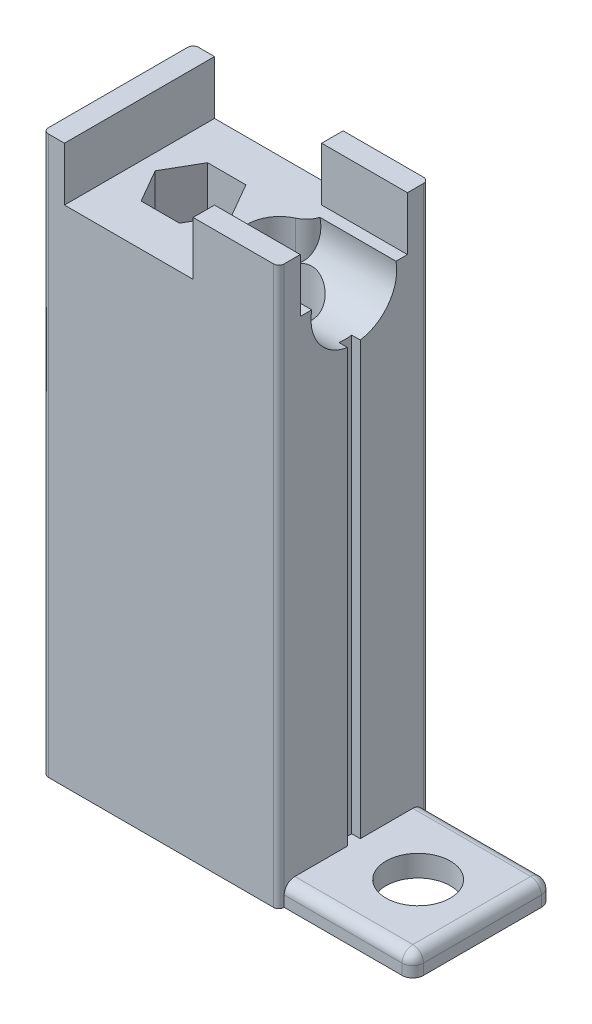
from build123d import *

# Parameters (mm, degrees)
SKETCH1_W                = 22
SKETCH1_H                = 14
BOSS_EXTRUDE1_DEPTH      = 47
SKETCH2_W                = 8
SKETCH2_H                = 2
SKETCH2_W_2              = 2
SKETCH2_H_2              = 14
BOSS_EXTRUDE2_DEPTH      = 5
SKETCH3_R                = 3
CUT_EXTRUDE1_DEPTH       = 54.749418602
SKETCH4_W                = 1.2
SKETCH4_H                = 47
CUT_EXTRUDE2_DEPTH       = 0.8
SKETCH5_R                = 4
CUT_EXTRUDE3_DEPTH       = 7
CUT_EXTRUDE4_DEPTH       = 1
FILLET1_R                = 2
FILLET2_R                = 0.5
BOSS_EXTRUDE3_DEPTH      = 12
BOSS_EXTRUDE3_DEPTH_BACK = 1
SKETCH8_W                = 13
SKETCH8_H                = 2
FILLET4_R                = 1
SKETCH9_R                = 3
CUT_EXTRUDE5_DEPTH       = 63.064482677


with BuildPart() as part:
    # Sketch1 → Boss-Extrude1 (new body)
    with BuildSketch(Plane(origin=(0, 0, 0), x_dir=(1, 0, 0), z_dir=(0, 1, 0))):
        with Locations((11, 7)):
            Rectangle(SKETCH1_W, SKETCH1_H)
    extrude(amount=BOSS_EXTRUDE1_DEPTH)

    # Sketch2 → Boss-Extrude2 (add)
    with BuildSketch(Plane(origin=(0, 47, 0), x_dir=(1, 0, 0), z_dir=(0, 1, 0))):
        with Locations((18, 1)):
            Rectangle(SKETCH2_W, SKETCH2_H)
        with Locations((1, 7)):
            Rectangle(SKETCH2_W_2, SKETCH2_H_2)
        with Locations((18, 13)):
            Rectangle(SKETCH2_W, SKETCH2_H)
    extrude(amount=BOSS_EXTRUDE2_DEPTH)

    # Sketch3 → Cut-Extrude1 (cut, through all)
    with BuildSketch(Plane(origin=(0, 47, 0), x_dir=(1, 0, 0), z_dir=(0, 1, 0))):
        with Locations(Location((15.082903769, 7, 0), (0, 0, 270))):
            Circle(SKETCH3_R)
        Polygon((10.621023553, 7), (8.831237719, 10.1), (5.25166605, 10.1), (3.461880215, 7), (5.25166605, 3.9), (8.831237719, 3.9), align=None)
    extrude(amount=-CUT_EXTRUDE1_DEPTH, mode=Mode.SUBTRACT)

    # Sketch4 → Cut-Extrude2 (cut)
    with BuildSketch(Plane(origin=(22, 0, 0), x_dir=(0, 0, -1), z_dir=(1, 0, 0))):
        with Locations((7, 23.5)):
            Rectangle(SKETCH4_W, SKETCH4_H)
    extrude(amount=-CUT_EXTRUDE2_DEPTH, mode=Mode.SUBTRACT)

    # Sketch5 → Cut-Extrude3 (cut)
    with BuildSketch(Plane(origin=(22, 0, 0), x_dir=(0, 0, -1), z_dir=(1, 0, 0))):
        with Locations((7, 46.25)):
            Circle(SKETCH5_R)
    extrude(amount=-CUT_EXTRUDE3_DEPTH, mode=Mode.SUBTRACT)

    # Sketch7 → Cut-Extrude4 (cut)
    # profile 1 of 9: a face of its own
    with BuildSketch(Plane.ZY):
        with BuildLine():
            add(Edge.make_bspline(
                [(-10.951322115, 35.58974359), (-10.890470326, 35.588168028), (-10.770335111, 35.585057512), (-10.593659562, 35.559128935), (-10.423400003, 35.516882035), (-10.259633426, 35.458155789), (-10.102769882, 35.381359592), (-9.952256062, 35.288670665), (-9.808631099, 35.178339561), (-9.673366747, 35.052940123), (-9.54835809, 34.91657371), (-9.440038016, 34.769751021), (-9.34766663, 34.616276382), (-9.271108979, 34.455738551), (-9.212796077, 34.287025729), (-9.171875502, 34.110998126), (-9.14558606, 33.927705822), (-9.14256237, 33.802908746), (-9.141025641, 33.739483173)],
                knots=[0, 0, 0, 0, 1.014329547, 2.002516266, 2.970391464, 3.935626869, 4.897733899, 5.877609409, 6.878433252, 7.912639331, 8.949961323, 9.958554974, 10.949718813, 11.932905612, 12.9188844, 13.919928257, 14.942845884, 16, 16, 16, 16], degree=3))
            add(Edge.make_bspline(
                [(-9.141025641, 33.739483173), (-9.142662191, 33.67677226), (-9.145887065, 33.553198393), (-9.170802252, 33.371595199), (-9.212411935, 33.197453219), (-9.269735803, 33.030378278), (-9.344904989, 32.871179629), (-9.435475032, 32.718840812), (-9.543835904, 32.574775566), (-9.666035258, 32.439061204), (-9.800566143, 32.315871298), (-9.943055706, 32.207310407), (-10.092846019, 32.115320004), (-10.249717836, 32.039942227), (-10.414007563, 31.98144431), (-10.585309383, 31.940169778), (-10.763612695, 31.915086412), (-10.884867595, 31.911882603), (-10.946414263, 31.91025641)],
                knots=[0, 0, 0, 0, 1.051557043, 2.072126891, 3.067553643, 4.050577992, 5.02905126, 6.015227836, 7.017913613, 8.04756643, 9.074058332, 10.072836633, 11.047628519, 12.017157415, 12.98668631, 13.966869689, 14.968021931, 16, 16, 16, 16], degree=3))
            add(Edge.make_bspline(
                [(-10.946414263, 31.91025641), (-11.010784698, 31.911715185), (-11.137263805, 31.914581478), (-11.322366544, 31.941838618), (-11.499710962, 31.982897391), (-11.667807263, 32.044175408), (-11.828367367, 32.120778081), (-11.980211588, 32.215118866), (-12.1232889, 32.327041858), (-12.256778585, 32.453680666), (-12.377720564, 32.592251298), (-12.484475583, 32.738638882), (-12.574525809, 32.891725147), (-12.647874538, 33.051581739), (-12.70569973, 33.217215189), (-12.746488832, 33.389634252), (-12.770583928, 33.568425405), (-12.773940235, 33.68986393), (-12.775641026, 33.751402244)],
                knots=[0, 0, 0, 0, 1.067978421, 2.098431617, 3.099715153, 4.085208694, 5.062210972, 6.048429807, 7.046490867, 8.072918869, 9.098532598, 10.095778865, 11.076610158, 12.041847152, 13.011192615, 13.984257998, 14.978533688, 16, 16, 16, 16], degree=3))
            add(Edge.make_bspline(
                [(-12.775641026, 33.751402244), (-12.77510722, 33.792801999), (-12.774046367, 33.875077294), (-12.761267278, 33.997005082), (-12.742869064, 34.116553003), (-12.715658978, 34.233244418), (-12.682605678, 34.34790253), (-12.63978046, 34.459460075), (-12.591033771, 34.569108792), (-12.534077855, 34.675553593), (-12.470748384, 34.777815097), (-12.401650293, 34.87541092), (-12.326609835, 34.967160983), (-12.24586874, 35.053668232), (-12.159148765, 35.134364048), (-12.06759062, 35.210390793), (-11.969418611, 35.279728925), (-11.866781415, 35.34407182), (-11.760257677, 35.402255985), (-11.650281045, 35.451780605), (-11.539117256, 35.495029613), (-11.42528131, 35.529163642), (-11.309993162, 35.556965452), (-11.192021192, 35.575351265), (-11.07243121, 35.588130001), (-10.991787619, 35.58920445), (-10.951322115, 35.58974359)],
                knots=[0, 0, 0, 0, 1.034744296, 2.056386356, 3.06226378, 4.057406941, 5.050368692, 6.043467995, 7.042652155, 8.049140477, 9.059438543, 10.048523776, 11.036952808, 12.020949711, 13.004946614, 13.997082645, 14.994316842, 16.007702937, 17.024872941, 18.026463647, 19.021641123, 20.005082605, 20.995858141, 21.984425357, 22.988620895, 24, 24, 24, 24], degree=3))
        make_face()
        with BuildLine():
            add(Edge.make_bspline(
                [(-10.961137821, 34.961538462), (-11.002091067, 34.960439594), (-11.082916387, 34.958270869), (-11.201472412, 34.941748119), (-11.315290383, 34.91535941), (-11.423739361, 34.877135687), (-11.527289375, 34.828486588), (-11.626123986, 34.7695821), (-11.718874539, 34.698397447), (-11.806777773, 34.618754215), (-11.886183881, 34.530013352), (-11.956341682, 34.434912425), (-12.015052461, 34.333610251), (-12.064223106, 34.227047904), (-12.101237705, 34.114027118), (-12.127602093, 33.995433197), (-12.144263403, 33.871061798), (-12.146363581, 33.786277978), (-12.147435897, 33.742988782)],
                knots=[0, 0, 0, 0, 1.033739768, 2.040188636, 3.016340934, 3.979330865, 4.937572243, 5.900995986, 6.878200029, 7.884839167, 8.891893314, 9.879764717, 10.863503415, 11.843163062, 12.837761627, 13.859916423, 14.907309254, 16, 16, 16, 16], degree=3))
            add(Edge.make_bspline(
                [(-12.147435897, 33.742988782), (-12.14601417, 33.695014616), (-12.14322782, 33.600993199), (-12.123622723, 33.463837288), (-12.090080353, 33.334307144), (-12.041645823, 33.213036278), (-11.981574298, 33.098678068), (-11.906974999, 32.992634136), (-11.81905608, 32.894269542), (-11.751324057, 32.836840195), (-11.716947115, 32.807692308)],
                knots=[0, 0, 0, 0, 1.078454662, 2.113592447, 3.107694534, 4.079536787, 5.043276885, 6.005368276, 6.987637804, 8, 8, 8, 8], degree=3))
            add(Edge.make_bspline(
                [(-11.716947115, 32.807692308), (-11.688785837, 32.786158968), (-11.633097758, 32.743577439), (-11.54420746, 32.689000474), (-11.452667957, 32.642222571), (-11.357788468, 32.604426578), (-11.259769373, 32.574696886), (-11.158624114, 32.553877671), (-11.054496006, 32.540811814), (-10.984079699, 32.539250196), (-10.948517628, 32.538461538)],
                knots=[0, 0, 0, 0, 1.023928204, 2.024787132, 3.009472467, 3.9914905, 4.972207045, 5.96565515, 6.972602802, 8, 8, 8, 8], degree=3))
            add(Edge.make_bspline(
                [(-10.948517628, 32.538461538), (-10.908268574, 32.539569723), (-10.829077294, 32.541750111), (-10.712728253, 32.558069457), (-10.601262339, 32.585687682), (-10.49398756, 32.623576093), (-10.39121325, 32.672836023), (-10.293441695, 32.733567544), (-10.200501474, 32.805024949), (-10.112710227, 32.885714071), (-10.032464878, 32.974804512), (-9.962453482, 33.070412698), (-9.901875993, 33.170432093), (-9.853727852, 33.276278322), (-9.81525089, 33.386952245), (-9.789203811, 33.502944012), (-9.772401751, 33.623775463), (-9.770300981, 33.706005535), (-9.769230769, 33.747896635)],
                knots=[0, 0, 0, 0, 1.026359118, 2.019393844, 2.989460624, 3.950973911, 4.916101784, 5.890408035, 6.881132271, 7.902007068, 8.92769091, 9.933912415, 10.920395702, 11.90457117, 12.894218921, 13.903490204, 14.931958862, 16, 16, 16, 16], degree=3))
            add(Edge.make_bspline(
                [(-9.769230769, 33.747896635), (-9.77033801, 33.789546849), (-9.772517446, 33.871528943), (-9.788865514, 33.992049736), (-9.816308592, 34.107529435), (-9.854310778, 34.218156627), (-9.902837557, 34.324039771), (-9.962845843, 34.424806517), (-10.034125073, 34.520359449), (-10.115034761, 34.61004741), (-10.203099983, 34.692464901), (-10.297646798, 34.763988302), (-10.396029681, 34.826139863), (-10.500506014, 34.874826886), (-10.6089383, 34.913615734), (-10.721988197, 34.942180399), (-10.840083889, 34.958154796), (-10.920426831, 34.960400519), (-10.961137821, 34.961538462)],
                knots=[0, 0, 0, 0, 1.055025985, 2.07665775, 3.074803781, 4.057872707, 5.035505728, 6.020516407, 7.023567878, 8.050795229, 9.077271434, 10.074415901, 11.050397877, 12.019801805, 12.988065821, 13.964604439, 14.968634123, 16, 16, 16, 16], degree=3))
        make_face(mode=Mode.SUBTRACT)
    # profile 2 of 9: a face of its own
    with BuildSketch(Plane.ZY):
        with BuildLine():
            Line((-8.602564103, 34.557692308), (-7.974358974, 34.557692308))
            Line((-7.974358974, 34.557692308), (-7.974358974, 33.330028045))
            add(Edge.make_bspline(
                [(-7.974358974, 33.330028045), (-7.974303189, 33.301279111), (-7.974196124, 33.246102887), (-7.971216857, 33.166859026), (-7.967036356, 33.094394144), (-7.961819373, 33.028622792), (-7.954032692, 32.969703171), (-7.945043297, 32.917747761), (-7.934852223, 32.872382216), (-7.91828025, 32.821816268), (-7.892353098, 32.766481563), (-7.853198511, 32.707737276), (-7.805770884, 32.656940644), (-7.750710999, 32.613640874), (-7.687456558, 32.579519704), (-7.616879042, 32.556396308), (-7.539866459, 32.540854981), (-7.48622731, 32.539280379), (-7.458333333, 32.538461538)],
                knots=[0, 0, 0, 0, 1.267339619, 2.432334223, 3.495366327, 4.467371443, 5.340232306, 6.114347373, 6.791623365, 7.387877112, 8.457231658, 9.474542289, 10.487879852, 11.508108106, 12.54995813, 13.638205937, 14.771795776, 16, 16, 16, 16], degree=3))
            add(Edge.make_bspline(
                [(-7.458333333, 32.538461538), (-7.43046411, 32.539396129), (-7.376686242, 32.541199563), (-7.299161264, 32.55526322), (-7.22841751, 32.579361764), (-7.163728396, 32.612048595), (-7.107001607, 32.655794351), (-7.057611912, 32.707920523), (-7.016026947, 32.76926797), (-6.996043454, 32.815031407), (-6.985777244, 32.838541667)],
                knots=[0, 0, 0, 0, 1.116871431, 2.155171802, 3.144773418, 4.104381479, 5.046960687, 6.001340237, 6.973219418, 8, 8, 8, 8], degree=3))
            add(Edge.make_bspline(
                [(-6.985777244, 32.838541667), (-6.982009889, 32.848985135), (-6.973693889, 32.872037886), (-6.966292484, 32.911807054), (-6.958326368, 32.958708348), (-6.952024887, 33.013697578), (-6.948459287, 33.076434189), (-6.944639112, 33.146997253), (-6.942692282, 33.225316491), (-6.942439814, 33.28024765), (-6.942307692, 33.308994391)],
                knots=[0, 0, 0, 0, 0.56094539, 1.238222264, 2.041156151, 2.969685991, 4.036367568, 5.220421584, 6.545382566, 8, 8, 8, 8], degree=3))
            Line((-6.942307692, 33.308994391), (-6.942307692, 34.557692308))
            Line((-6.942307692, 34.557692308), (-6.314102564, 34.557692308))
            Line((-6.314102564, 34.557692308), (-6.314102564, 33.482872596))
            add(Edge.make_bspline(
                [(-6.314102564, 33.482872596), (-6.314211337, 33.429580756), (-6.314419888, 33.327404167), (-6.320396831, 33.180835172), (-6.328645689, 33.047574701), (-6.339268631, 32.927255846), (-6.354574979, 32.819828674), (-6.373364336, 32.725545105), (-6.394151363, 32.643782101), (-6.413213843, 32.595336955), (-6.422075321, 32.572816506)],
                knots=[0, 0, 0, 0, 1.388070971, 2.661352173, 3.82033814, 4.865898334, 5.806910977, 6.645039373, 7.370126333, 8, 8, 8, 8], degree=3))
            add(Edge.make_bspline(
                [(-6.422075321, 32.572816506), (-6.433433453, 32.548577546), (-6.45585343, 32.500731919), (-6.494756259, 32.432706035), (-6.536695687, 32.368256899), (-6.583667209, 32.308901581), (-6.63471199, 32.254036828), (-6.688387154, 32.202415433), (-6.747109954, 32.156139496), (-6.809357488, 32.114018206), (-6.875998336, 32.076627493), (-6.946576055, 32.043492987), (-7.021853352, 32.016527181), (-7.101177481, 31.993669858), (-7.184914076, 31.976623976), (-7.272894458, 31.96371302), (-7.365215122, 31.95704059), (-7.428176105, 31.955776111), (-7.460436699, 31.955128205)],
                knots=[0, 0, 0, 0, 0.997311338, 1.968606903, 2.91805772, 3.860812155, 4.785445165, 5.709667791, 6.633356648, 7.568312411, 8.508286151, 9.478643871, 10.470653671, 11.485274776, 12.552984541, 13.653035246, 14.797438149, 16, 16, 16, 16], degree=3))
            add(Edge.make_bspline(
                [(-7.460436699, 31.955128205), (-7.495287205, 31.955543531), (-7.563477828, 31.956356183), (-7.663103376, 31.966307989), (-7.758047863, 31.979184332), (-7.847251238, 32.001076476), (-7.93195927, 32.026439619), (-8.011199462, 32.058809736), (-8.085295609, 32.096867822), (-8.154393505, 32.140388247), (-8.217957253, 32.189769831), (-8.277400263, 32.242878005), (-8.330803459, 32.301825775), (-8.379910239, 32.364792811), (-8.424172542, 32.432358629), (-8.46361234, 32.504282986), (-8.498263038, 32.580893031), (-8.516750904, 32.634585733), (-8.526141827, 32.661858974)],
                knots=[0, 0, 0, 0, 1.211240017, 2.369985978, 3.478996442, 4.539426614, 5.559871561, 6.551301256, 7.510778031, 8.453136967, 9.386094087, 10.30661716, 11.221130616, 12.147659962, 13.080758632, 14.026335491, 14.997475882, 16, 16, 16, 16], degree=3))
            add(Edge.make_bspline(
                [(-8.526141827, 32.661858974), (-8.532548621, 32.683040418), (-8.546350349, 32.728670185), (-8.561251986, 32.804501531), (-8.573170857, 32.891901404), (-8.584765159, 32.990955773), (-8.592853555, 33.101830703), (-8.598140227, 33.22435011), (-8.601712268, 33.358753581), (-8.602271792, 33.45225447), (-8.602564103, 33.501101763)],
                knots=[0, 0, 0, 0, 0.627914866, 1.352675004, 2.190563461, 3.132055958, 4.183353232, 5.345633452, 6.613289997, 8, 8, 8, 8], degree=3))
            Line((-8.602564103, 33.501101763), (-8.602564103, 34.557692308))
        make_face()
    # profile 3 of 9: a face of its own
    with BuildSketch(Plane.ZY):
        with BuildLine():
            Line((-6, 34.557692308), (-5.775641026, 34.557692308))
            add(Edge.make_bspline(
                [(-5.775641026, 34.557692308), (-5.775491092, 34.598358179), (-5.775207588, 34.675251814), (-5.773533261, 34.784154592), (-5.77240418, 34.879983975), (-5.770387392, 34.962725223), (-5.767548978, 35.032135973), (-5.764639304, 35.088212431), (-5.762459762, 35.131308407), (-5.759386899, 35.155525301), (-5.758112981, 35.165564904)],
                knots=[0, 0, 0, 0, 1.604323161, 3.033556972, 4.296844687, 5.385167547, 6.298701784, 7.037230881, 7.60086462, 8, 8, 8, 8], degree=3))
            add(Edge.make_bspline(
                [(-5.758112981, 35.165564904), (-5.752139427, 35.200009514), (-5.74049495, 35.267153717), (-5.701947969, 35.360739137), (-5.645936098, 35.442262753), (-5.586560077, 35.499806431), (-5.531533727, 35.539090043), (-5.485371192, 35.564747575), (-5.435177847, 35.586743924), (-5.380791518, 35.603991697), (-5.322729456, 35.618080923), (-5.26036507, 35.627875054), (-5.194040512, 35.633272479), (-5.148380312, 35.634160615), (-5.125, 35.634615385)],
                knots=[0, 0, 0, 0, 1.43722947, 2.801646624, 4.13175475, 5.486897933, 6.18427957, 6.91287343, 7.658885333, 8.438447905, 9.260561323, 10.118602268, 11.036630026, 12, 12, 12, 12], degree=3))
            add(Edge.make_bspline(
                [(-5.125, 35.634615385), (-5.089177518, 35.63349749), (-5.014566492, 35.63116914), (-4.899932721, 35.612345867), (-4.778314287, 35.583530481), (-4.696435606, 35.556716043), (-4.653846154, 35.542768429)],
                knots=[0, 0, 0, 0, 0.891275659, 1.856347963, 2.884972697, 4, 4, 4, 4], degree=3))
            Line((-4.653846154, 35.542768429), (-4.653846154, 35.054086538))
            add(Edge.make_bspline(
                [(-4.653846154, 35.054086538), (-4.676689638, 35.060402377), (-4.720257268, 35.072448092), (-4.782944185, 35.085819906), (-4.839426998, 35.094076968), (-4.874910775, 35.095491484), (-4.891526442, 35.096153846)],
                knots=[0, 0, 0, 0, 1.174725213, 2.24046353, 3.176077791, 4, 4, 4, 4], degree=3))
            add(Edge.make_bspline(
                [(-4.891526442, 35.096153846), (-4.909813153, 35.095768488), (-4.94407963, 35.095046386), (-4.991577954, 35.085859837), (-5.032246647, 35.071395208), (-5.053340981, 35.054875554), (-5.063301282, 35.047075321)],
                knots=[0, 0, 0, 0, 1.199997209, 2.248609783, 3.173030359, 4, 4, 4, 4], degree=3))
            add(Edge.make_bspline(
                [(-5.063301282, 35.047075321), (-5.069328506, 35.039376052), (-5.082644613, 35.022365852), (-5.0947481, 34.987655434), (-5.100892906, 34.943784529), (-5.101972568, 34.911317787), (-5.102564103, 34.893529647)],
                knots=[0, 0, 0, 0, 0.721105823, 1.593158367, 2.681320256, 4, 4, 4, 4], degree=3))
            Line((-5.102564103, 34.893529647), (-5.104667468, 34.557692308))
            Line((-5.104667468, 34.557692308), (-4.698717949, 34.557692308))
            Line((-4.698717949, 34.557692308), (-4.698717949, 34.019230769))
            Line((-4.698717949, 34.019230769), (-5.147435897, 34.019230769))
            Line((-5.147435897, 34.019230769), (-5.147435897, 32))
            Line((-5.147435897, 32), (-5.775641026, 32))
            Line((-5.775641026, 32), (-5.775641026, 34.019230769))
            Line((-5.775641026, 34.019230769), (-6, 34.019230769))
            Line((-6, 34.019230769), (-6, 34.557692308))
        make_face()
    # profile 4 of 9: a face of its own
    with BuildSketch(Plane.ZY):
        with BuildLine():
            Line((-4.653846154, 34.557692308), (-4.429487179, 34.557692308))
            add(Edge.make_bspline(
                [(-4.429487179, 34.557692308), (-4.429337246, 34.598358179), (-4.429053742, 34.675251814), (-4.427379415, 34.784154592), (-4.426250334, 34.879983975), (-4.424233546, 34.962725223), (-4.421395132, 35.032135973), (-4.418485458, 35.088212431), (-4.416305916, 35.131308407), (-4.413233052, 35.155525301), (-4.411959135, 35.165564904)],
                knots=[0, 0, 0, 0, 1.604323161, 3.033556972, 4.296844687, 5.385167547, 6.298701784, 7.037230881, 7.60086462, 8, 8, 8, 8], degree=3))
            add(Edge.make_bspline(
                [(-4.411959135, 35.165564904), (-4.405985581, 35.200009514), (-4.394341103, 35.267153717), (-4.355794122, 35.360739137), (-4.299782252, 35.442262753), (-4.24040623, 35.499806431), (-4.18537988, 35.539090043), (-4.139217346, 35.564747575), (-4.089024, 35.586743924), (-4.034637672, 35.603991697), (-3.97657561, 35.618080923), (-3.914211224, 35.627875054), (-3.847886666, 35.633272479), (-3.802226466, 35.634160615), (-3.778846154, 35.634615385)],
                knots=[0, 0, 0, 0, 1.43722947, 2.801646624, 4.13175475, 5.486897933, 6.18427957, 6.91287343, 7.658885333, 8.438447905, 9.260561323, 10.118602268, 11.036630026, 12, 12, 12, 12], degree=3))
            add(Edge.make_bspline(
                [(-3.778846154, 35.634615385), (-3.743023672, 35.63349749), (-3.668412646, 35.63116914), (-3.553778875, 35.612345867), (-3.432160441, 35.583530481), (-3.35028176, 35.556716043), (-3.307692308, 35.542768429)],
                knots=[0, 0, 0, 0, 0.891275659, 1.856347963, 2.884972697, 4, 4, 4, 4], degree=3))
            Line((-3.307692308, 35.542768429), (-3.307692308, 35.054086538))
            add(Edge.make_bspline(
                [(-3.307692308, 35.054086538), (-3.330535792, 35.060402377), (-3.374103422, 35.072448092), (-3.436790339, 35.085819906), (-3.493273152, 35.094076968), (-3.528756929, 35.095491484), (-3.545372596, 35.096153846)],
                knots=[0, 0, 0, 0, 1.174725213, 2.24046353, 3.176077791, 4, 4, 4, 4], degree=3))
            add(Edge.make_bspline(
                [(-3.545372596, 35.096153846), (-3.563659307, 35.095768488), (-3.597925784, 35.095046386), (-3.645424108, 35.085859837), (-3.6860928, 35.071395208), (-3.707187135, 35.054875554), (-3.717147436, 35.047075321)],
                knots=[0, 0, 0, 0, 1.199997209, 2.248609783, 3.173030359, 4, 4, 4, 4], degree=3))
            add(Edge.make_bspline(
                [(-3.717147436, 35.047075321), (-3.72317466, 35.039376052), (-3.736490767, 35.022365852), (-3.748594254, 34.987655434), (-3.754739059, 34.943784529), (-3.755818722, 34.911317787), (-3.756410256, 34.893529647)],
                knots=[0, 0, 0, 0, 0.721105823, 1.593158367, 2.681320256, 4, 4, 4, 4], degree=3))
            Line((-3.756410256, 34.893529647), (-3.758513622, 34.557692308))
            Line((-3.758513622, 34.557692308), (-3.352564103, 34.557692308))
            Line((-3.352564103, 34.557692308), (-3.352564103, 34.019230769))
            Line((-3.352564103, 34.019230769), (-3.801282051, 34.019230769))
            Line((-3.801282051, 34.019230769), (-3.801282051, 32))
            Line((-3.801282051, 32), (-4.429487179, 32))
            Line((-4.429487179, 32), (-4.429487179, 34.019230769))
            Line((-4.429487179, 34.019230769), (-4.653846154, 34.019230769))
            Line((-4.653846154, 34.019230769), (-4.653846154, 34.557692308))
        make_face()
    # profile 5 of 9: a face of its own
    with BuildSketch(Plane.ZY):
        with BuildLine():
            Line((-3.307692308, 34.557692308), (-3.083333333, 34.557692308))
            add(Edge.make_bspline(
                [(-3.083333333, 34.557692308), (-3.0831834, 34.598358179), (-3.082899896, 34.675251814), (-3.081225569, 34.784154592), (-3.080096487, 34.879983975), (-3.0780797, 34.962725223), (-3.075241286, 35.032135973), (-3.072331611, 35.088212431), (-3.07015207, 35.131308407), (-3.067079206, 35.155525301), (-3.065805288, 35.165564904)],
                knots=[0, 0, 0, 0, 1.604323161, 3.033556972, 4.296844687, 5.385167547, 6.298701784, 7.037230881, 7.60086462, 8, 8, 8, 8], degree=3))
            add(Edge.make_bspline(
                [(-3.065805288, 35.165564904), (-3.059831735, 35.200009514), (-3.048187257, 35.267153717), (-3.009640276, 35.360739137), (-2.953628406, 35.442262753), (-2.894252384, 35.499806431), (-2.839226034, 35.539090043), (-2.793063499, 35.564747575), (-2.742870154, 35.586743924), (-2.688483826, 35.603991697), (-2.630421764, 35.618080923), (-2.568057377, 35.627875054), (-2.501732819, 35.633272479), (-2.45607262, 35.634160615), (-2.432692308, 35.634615385)],
                knots=[0, 0, 0, 0, 1.43722947, 2.801646624, 4.13175475, 5.486897933, 6.18427957, 6.91287343, 7.658885333, 8.438447905, 9.260561323, 10.118602268, 11.036630026, 12, 12, 12, 12], degree=3))
            add(Edge.make_bspline(
                [(-2.432692308, 35.634615385), (-2.396869826, 35.63349749), (-2.3222588, 35.63116914), (-2.207625029, 35.612345867), (-2.086006595, 35.583530481), (-2.004127913, 35.556716043), (-1.961538462, 35.542768429)],
                knots=[0, 0, 0, 0, 0.891275659, 1.856347963, 2.884972697, 4, 4, 4, 4], degree=3))
            Line((-1.961538462, 35.542768429), (-1.961538462, 35.054086538))
            add(Edge.make_bspline(
                [(-1.961538462, 35.054086538), (-1.984381946, 35.060402377), (-2.027949575, 35.072448092), (-2.090636492, 35.085819906), (-2.147119306, 35.094076968), (-2.182603083, 35.095491484), (-2.19921875, 35.096153846)],
                knots=[0, 0, 0, 0, 1.174725213, 2.24046353, 3.176077791, 4, 4, 4, 4], degree=3))
            add(Edge.make_bspline(
                [(-2.19921875, 35.096153846), (-2.217505461, 35.095768488), (-2.251771938, 35.095046386), (-2.299270262, 35.085859837), (-2.339938954, 35.071395208), (-2.361033289, 35.054875554), (-2.37099359, 35.047075321)],
                knots=[0, 0, 0, 0, 1.199997209, 2.248609783, 3.173030359, 4, 4, 4, 4], degree=3))
            add(Edge.make_bspline(
                [(-2.37099359, 35.047075321), (-2.377020814, 35.039376052), (-2.390336921, 35.022365852), (-2.402440408, 34.987655434), (-2.408585213, 34.943784529), (-2.409664876, 34.911317787), (-2.41025641, 34.893529647)],
                knots=[0, 0, 0, 0, 0.721105823, 1.593158367, 2.681320256, 4, 4, 4, 4], degree=3))
            Line((-2.41025641, 34.893529647), (-2.412359776, 34.557692308))
            Line((-2.412359776, 34.557692308), (-2.006410256, 34.557692308))
            Line((-2.006410256, 34.557692308), (-2.006410256, 34.019230769))
            Line((-2.006410256, 34.019230769), (-2.455128205, 34.019230769))
            Line((-2.455128205, 34.019230769), (-2.455128205, 32))
            Line((-2.455128205, 32), (-3.083333333, 32))
            Line((-3.083333333, 32), (-3.083333333, 34.019230769))
            Line((-3.083333333, 34.019230769), (-3.307692308, 34.019230769))
            Line((-3.307692308, 34.019230769), (-3.307692308, 34.557692308))
        make_face()
    # profile 6 of 9: a face of its own
    with BuildSketch(Plane.ZY):
        Polygon((-12.955128205, 28.801282051), (-11.070512821, 28.801282051), (-11.070512821, 28.173076923), (-11.698717949, 28.173076923), (-11.698717949, 25.301282051), (-12.326923077, 25.301282051), (-12.326923077, 28.173076923), (-12.955128205, 28.173076923), align=None)
    # profile 7 of 9: a face of its own
    with BuildSketch(Plane.ZY):
        Polygon((-10.576923077, 28.801282051), (-8.692307692, 28.801282051), (-8.692307692, 28.173076923), (-9.948717949, 28.173076923), (-9.948717949, 27.5), (-8.692307692, 27.5), (-8.692307692, 26.871794872), (-9.948717949, 26.871794872), (-9.948717949, 25.929487179), (-8.692307692, 25.929487179), (-8.692307692, 25.301282051), (-10.576923077, 25.301282051), align=None)
    # profile 8 of 9: a face of its own
    with BuildSketch(Plane.ZY):
        Polygon((-6.986478365, 28.801282051), (-6.403846154, 28.801282051), (-4.990384615, 25.301282051), (-5.661358173, 25.301282051), (-5.933393429, 26.019230769), (-7.458333333, 26.019230769), (-7.73036859, 25.301282051), (-8.400641026, 25.301282051), align=None)
        Polygon((-6.695512821, 27.862479968), (-7.219951923, 26.647435897), (-6.171073718, 26.647435897), align=None, mode=Mode.SUBTRACT)
    # profile 9 of 9: a face of its own
    with BuildSketch(Plane.ZY):
        Polygon((-4.197415865, 28.801282051), (-3.545372596, 28.801282051), (-2.746794872, 26.359975962), (-1.942608173, 28.801282051), (-1.296875, 28.801282051), (-0.705128205, 25.301282051), (-1.341045673, 25.301282051), (-1.71474359, 27.511919071), (-2.442508013, 25.301282051), (-3.055288462, 25.301282051), (-3.778846154, 27.511919071), (-4.151842949, 25.301282051), (-4.788461538, 25.301282051), align=None)
    extrude(amount=-CUT_EXTRUDE4_DEPTH, mode=Mode.SUBTRACT)

    # Fillet1
    # the kernel refuses this fillet: 2 mm, written as the material it takes off along each edge
    with BuildSketch(Plane(origin=(15, 39.736351863, -9.998854275), x_dir=(0, 0, -1), z_dir=(0, 1, 0))) as fillet1_piece_1_section:
        with BuildLine():
            CenterArc((1.546639305, 2), FILLET1_R, 204.618903588, 65.381096412)
            ThreePointArc((-0.271558127, 1.166838493), (-0.076940915, 0.597112639), (0, 0))
            Line((0, 0), (1.546639305, 0))
        make_face()
    fillet1_piece_1 = extrude(amount=11.130246399, mode=Mode.PRIVATE)
    fillet1_piece_1 = fillet1_piece_1 & Plane(origin=(14.709351752, 46.25, -7), x_dir=(0, 0, -1), z_dir=(1, 0, 0)) * Cylinder(4, 29, mode=Mode.PRIVATE)
    add(fillet1_piece_1, mode=Mode.SUBTRACT)
    with BuildSketch(Plane(origin=(15, 39.736351863, -4.001145725), x_dir=(-0.9739711201333566, 0, -0.2266721357956792), z_dir=(0, 1, 0))) as fillet1_piece_2_section:
        with BuildLine():
            CenterArc((1.597362206, 1.959726288), FILLET1_R, 193.101225266, 65.381096412)
            Line((-0.350580035, 1.506382016), (0, 0))
            ThreePointArc((0, 0), (0.599010827, 0.060410568), (1.198021654, 0))
        make_face()
    fillet1_piece_2 = extrude(amount=11.130246399, mode=Mode.PRIVATE)
    fillet1_piece_2 = fillet1_piece_2 & Plane(origin=(14.709351569, 46.25, -7), x_dir=(0, 0, -1), z_dir=(1, 0, 0)) * Cylinder(4, 29, mode=Mode.PRIVATE)
    add(fillet1_piece_2, mode=Mode.SUBTRACT)

    # Fillet2
    fillet2_edges = [part.edges().sort_by_distance(p)[0] for p in [
        (0, 26, -14),
        (22, 26, -14),
        (22, 26, 0),
        (0, 26, 0),
    ]]
    fillet(fillet2_edges, radius=FILLET2_R)

    # Sketch8 → Boss-Extrude3 (add, two sides: drawn at the far end of the back side and taken through both)
    with BuildSketch(Plane(origin=(22, 0, 0), x_dir=(0, 0, -1), z_dir=(1, 0, 0)).offset(-BOSS_EXTRUDE3_DEPTH_BACK)):
        with Locations((7, 1)):
            Rectangle(SKETCH8_W, SKETCH8_H)
    extrude(amount=BOSS_EXTRUDE3_DEPTH + BOSS_EXTRUDE3_DEPTH_BACK)

    # Fillet4
    fillet4_edges = [part.edges().sort_by_distance(p)[0] for p in [
        (28, 2, -0.5),
        (28, 2, -13.5),
        (34, 1, -0.5),
        (34, 1, -13.5),
        (34, 2, -7),
    ]]
    fillet(fillet4_edges, radius=FILLET4_R)

    # Sketch9 → Cut-Extrude5 (cut, through all)
    with BuildSketch(Plane(origin=(0, 2, 0), x_dir=(1, 0, 0), z_dir=(0, 1, 0))):
        with Locations(Location((28, 7, 0), (0, 0, 270))):
            Circle(SKETCH9_R)
    extrude(amount=-CUT_EXTRUDE5_DEPTH, mode=Mode.SUBTRACT)


solid = part.part
